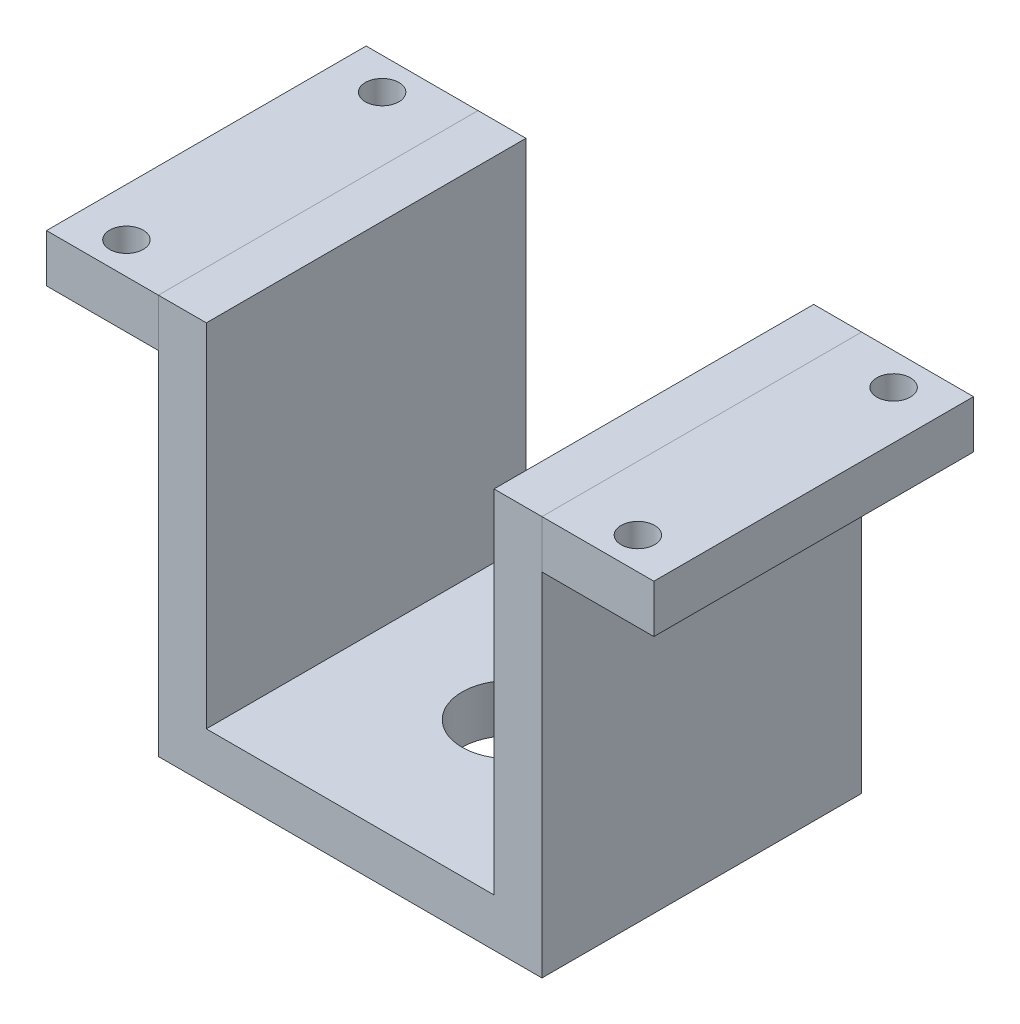
from build123d import *

# Parameters (mm, degrees)
SKETCH_1_W        = 18
SKETCH_1_H        = 20
SKETCH_1_R        = 3
EXTRUDE_2_DEPTH   = 3
SKETCH_1_3_W      = 3
SKETCH_1_3_H      = 20
EXTRUDE_3_DEPTH   = 25
SKETCH_2_W        = 7
SKETCH_2_H        = 20
SKETCH_2_R        = 1.05
EXTRUDE_4_DEPTH   = 3
EXTRUDE_4_2_DEPTH = 3


with BuildPart() as part:
    # 草圖1 → 填料-伸長2 (new body)
    with BuildSketch(Plane(origin=(0, 0, 0), x_dir=(1, 0, 0), z_dir=(0, 1, 0))):
        Rectangle(SKETCH_1_W, SKETCH_1_H)
        Circle(SKETCH_1_R, mode=Mode.SUBTRACT)
    extrude(amount=EXTRUDE_2_DEPTH)

    # 草圖1<3> → 填料-伸長3 (add)
    with BuildSketch(Plane(origin=(0, 0, 0), x_dir=(1, 0, 0), z_dir=(0, 1, 0))):
        with Locations((-10.5, 0)):
            Rectangle(SKETCH_1_3_W, SKETCH_1_3_H)
        with Locations((10.5, 0)):
            Rectangle(SKETCH_1_3_W, SKETCH_1_3_H)
    extrude(amount=EXTRUDE_3_DEPTH)


with BuildPart() as body_2:
    # 草圖2 → 填料-伸長4 (new body)
    with BuildSketch(Plane(origin=(0, 25, 0), x_dir=(1, 0, 0), z_dir=(0, 1, 0))):
        with Locations((-15.5, 0)):
            Rectangle(SKETCH_2_W, SKETCH_2_H)
        with Locations((-16, 8)):
            Circle(SKETCH_2_R, mode=Mode.SUBTRACT)
        with Locations((-16, -8)):
            Circle(SKETCH_2_R, mode=Mode.SUBTRACT)
    extrude(amount=-EXTRUDE_4_DEPTH)


with BuildPart() as body_3:
    # 草圖2 → Extrude 4 2 (new body)
    with BuildSketch(Plane(origin=(0, 25, 0), x_dir=(1, 0, 0), z_dir=(0, 1, 0))):
        with Locations((15.5, 0)):
            Rectangle(SKETCH_2_W, SKETCH_2_H)
        with Locations((16, 8)):
            Circle(SKETCH_2_R, mode=Mode.SUBTRACT)
        with Locations((16, -8)):
            Circle(SKETCH_2_R, mode=Mode.SUBTRACT)
    extrude(amount=-EXTRUDE_4_2_DEPTH)


solid = Compound([part.part, body_2.part, body_3.part])
